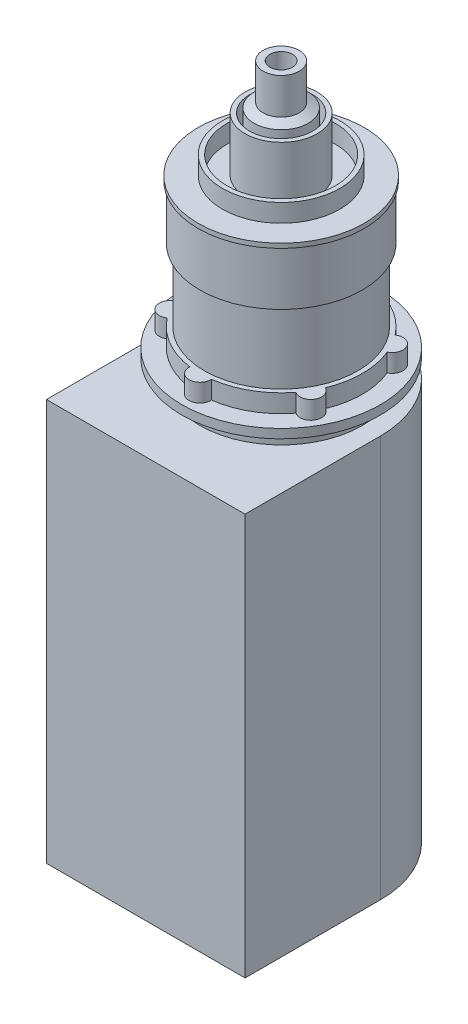
from build123d import *

# Parameters (mm, degrees)
BOSS_EXTRUDE1_DEPTH  = 139.7
SHELL1_T             = -1.5875
BOSS_EXTRUDE2_DEPTH  = 1.5875
SKETCH3_R            = 28.575
BOSS_EXTRUDE3_DEPTH  = 6.35
SKETCH4_R            = 34.925
BOSS_EXTRUDE4_DEPTH  = 3.175
BOSS_EXTRUDE5_DEPTH  = 6.35
SKETCH6_R            = 26.9875
BOSS_EXTRUDE6_DEPTH  = 25.4
SKETCH8_R            = 28.575
BOSS_EXTRUDE7_DEPTH  = 19.05
SKETCH9_R            = 29.21
BOSS_EXTRUDE8_DEPTH  = 1.5875
SKETCH10_R           = 20.6375
SKETCH10_R_2         = 19.05
BOSS_EXTRUDE9_DEPTH  = 6.35
SKETCH12_R           = 12.7
SKETCH12_R_2         = 11.1125
BOSS_EXTRUDE10_DEPTH = 19.05
SKETCH15_R           = 3.96875
CUT_EXTRUDE1_DEPTH   = 19.05


with BuildPart() as part:
    # Sketch1 → Boss-Extrude1 (new body)
    with BuildSketch(Plane(origin=(0, 0, 0), x_dir=(1, 0, 0), z_dir=(0, 1, 0))):
        with BuildLine():
            Line((-34.925, 0), (34.925, 0))
            Line((34.925, 0), (34.925, 47.625))
            ThreePointArc((34.925, 47.625), (0, 82.55), (-34.925, 47.625))
            Line((-34.925, 47.625), (-34.925, 0))
        make_face()
    extrude(amount=BOSS_EXTRUDE1_DEPTH)

    # Shell1
    shell1_openings = [part.faces().sort_by_distance(p)[0] for p in [
        (0, 139.7, -37.932310571),
    ]]
    offset(amount=SHELL1_T, openings=shell1_openings, kind=Kind.INTERSECTION)

    # Sketch2 → Boss-Extrude2 (add)
    with BuildSketch(Plane(origin=(0, 139.7, 0), x_dir=(1, 0, 0), z_dir=(0, 1, 0))):
        with BuildLine():
            Line((34.925, 0), (34.925, 47.625))
            ThreePointArc((34.925, 47.625), (0, 82.55), (-34.925, 47.625))
            Line((-34.925, 47.625), (-34.925, 0))
            Line((-34.925, 0), (34.925, 0))
        make_face()
    extrude(amount=BOSS_EXTRUDE2_DEPTH)

    # Sketch3 → Boss-Extrude3 (add)
    with BuildSketch(Plane(origin=(0, 141.2875, 0), x_dir=(1, 0, 0), z_dir=(0, 1, 0))):
        with Locations((0, 47.625)):
            Circle(SKETCH3_R)
    extrude(amount=BOSS_EXTRUDE3_DEPTH)

    # Sketch4 → Boss-Extrude4 (add)
    with BuildSketch(Plane(origin=(0, 147.6375, 0), x_dir=(1, 0, 0), z_dir=(0, 1, 0))):
        with Locations((0, 47.625)):
            Circle(SKETCH4_R)
    extrude(amount=BOSS_EXTRUDE4_DEPTH)

    # Sketch5 → Boss-Extrude5 (add)
    with BuildSketch(Plane(origin=(0, 150.8125, 0), x_dir=(1, 0, 0), z_dir=(0, 1, 0))):
        with BuildLine():
            ThreePointArc((-3.801523905, 75.946), (-14.2875, 72.371675913), (-22.625943508, 65.077716275))
            ThreePointArc((-22.625943508, 65.077716275), (-28.046232702, 63.8175), (-26.427467413, 58.493283725))
            ThreePointArc((-26.427467413, 58.493283725), (-28.575, 47.625), (-26.427467413, 36.756716275))
            ThreePointArc((-26.427467413, 36.756716275), (-28.046232702, 31.4325), (-22.625943508, 30.172283725))
            ThreePointArc((-22.625943508, 30.172283725), (-14.2875, 22.878324087), (-3.801523905, 19.304))
            ThreePointArc((-3.801523905, 19.304), (0, 15.24), (3.801523905, 19.304))
            ThreePointArc((3.801523905, 19.304), (14.2875, 22.878324087), (22.625943508, 30.172283725))
            ThreePointArc((22.625943508, 30.172283725), (28.046232702, 31.4325), (26.427467413, 36.756716275))
            ThreePointArc((26.427467413, 36.756716275), (28.575, 47.625), (26.427467413, 58.493283725))
            ThreePointArc((26.427467413, 58.493283725), (28.046232702, 63.8175), (22.625943508, 65.077716275))
            ThreePointArc((22.625943508, 65.077716275), (14.2875, 72.371675913), (3.801523905, 75.946))
            ThreePointArc((3.801523905, 75.946), (0, 80.01), (-3.801523905, 75.946))
        make_face()
    extrude(amount=BOSS_EXTRUDE5_DEPTH)

    # Sketch6 → Boss-Extrude6 (add)
    with BuildSketch(Plane(origin=(0, 157.1625, 0), x_dir=(1, 0, 0), z_dir=(0, 1, 0))):
        with Locations((0, 47.625)):
            Circle(SKETCH6_R)
    extrude(amount=BOSS_EXTRUDE6_DEPTH)

    # Sketch8 → Boss-Extrude7 (add)
    with BuildSketch(Plane(origin=(0, 182.5625, 0), x_dir=(1, 0, 0), z_dir=(0, 1, 0))):
        with Locations((0, 47.625)):
            Circle(SKETCH8_R)
    extrude(amount=BOSS_EXTRUDE7_DEPTH)

    # Sketch9 → Boss-Extrude8 (add)
    with BuildSketch(Plane(origin=(0, 201.6125, 0), x_dir=(1, 0, 0), z_dir=(0, 1, 0))):
        with Locations((0, 47.625)):
            Circle(SKETCH9_R)
    extrude(amount=BOSS_EXTRUDE8_DEPTH)

    # Sketch10 → Boss-Extrude9 (add)
    with BuildSketch(Plane(origin=(0, 203.2, 0), x_dir=(1, 0, 0), z_dir=(0, 1, 0))):
        with Locations((0, 47.625)):
            Circle(SKETCH10_R)
        with Locations((0, 47.625)):
            Circle(SKETCH10_R_2, mode=Mode.SUBTRACT)
    extrude(amount=BOSS_EXTRUDE9_DEPTH)

    # Sketch12 → Boss-Extrude10 (add)
    with BuildSketch(Plane(origin=(0, 203.2, 0), x_dir=(1, 0, 0), z_dir=(0, 1, 0))):
        with Locations((0, 47.625)):
            Circle(SKETCH12_R)
        with Locations((0, 47.625)):
            Circle(SKETCH12_R_2, mode=Mode.SUBTRACT)
    extrude(amount=BOSS_EXTRUDE10_DEPTH)

    # Sketch14 → Revolve1 (revolve)
    with BuildSketch(Plane(origin=(0, 0, 0), x_dir=(0, 0, -1), z_dir=(1, 0, 0))):
        Polygon((47.625, 238.125), (53.975, 238.125), (53.975, 225.425), (57.15, 223.8375), (57.15, 203.2), (47.625, 203.2), align=None)
    revolve(axis=Axis((0, 235.492882867, -47.625), (0, -1, 0)))

    # Sketch15 → Cut-Extrude1 (cut)
    with BuildSketch(Plane(origin=(0, 238.125, 0), x_dir=(1, 0, 0), z_dir=(0, 1, 0))):
        with Locations((0, 47.625)):
            Circle(SKETCH15_R)
    extrude(amount=-CUT_EXTRUDE1_DEPTH, mode=Mode.SUBTRACT)


solid = part.part
